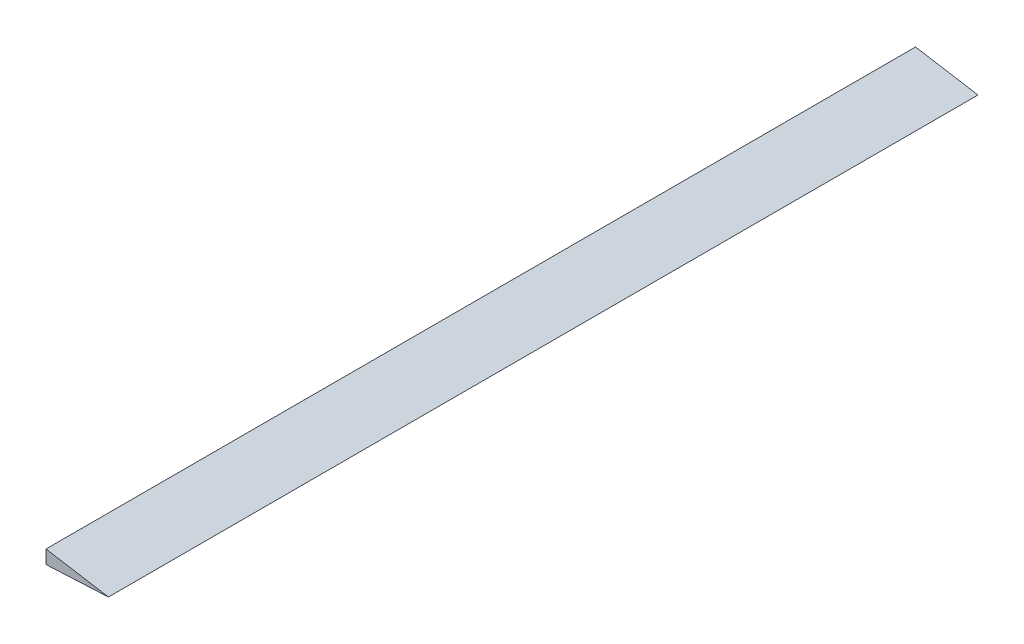
from build123d import *

# Parameters (mm, degrees)
BOSS_EXTRUDE2_DEPTH = 707.39


with BuildPart() as part:
    # Sketch2 → Boss-Extrude2 (new body)
    with BuildSketch(Plane(origin=(0, 0, -761.999746), x_dir=(-1, 0, 0), z_dir=(0, 0, -1))):
        Polygon((-306.8495768, -2.516115741), (-306.8495768, 8.449856001), (-357.6495768, 0), align=None)
    extrude(amount=-BOSS_EXTRUDE2_DEPTH)


solid = part.part
